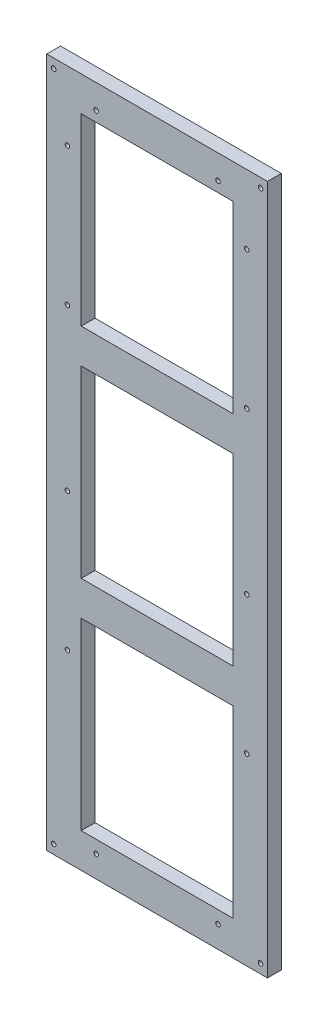
from build123d import *

# Parameters (mm, degrees)
SKETCH1_W           = 96
SKETCH1_H           = 300
SKETCH1_W_2         = 66
SKETCH1_H_2         = 80
BOSS_EXTRUDE1_DEPTH = 6
SKETCH3_R           = 1
CUT_EXTRUDE6_DEPTH  = 10
SKETCH5_R           = 1
CUT_EXTRUDE9_DEPTH  = 10
SKETCH7_R           = 1
CUT_EXTRUDE10_DEPTH = 10


with BuildPart() as part:
    # Sketch1 → Boss-Extrude1 (new body)
    with BuildSketch(Plane.XY):
        with Locations((0, 6)):
            Rectangle(SKETCH1_W, SKETCH1_H)
        with Locations((0, 101)):
            Rectangle(SKETCH1_W_2, SKETCH1_H_2, mode=Mode.SUBTRACT)
        with Locations((0, -89)):
            Rectangle(SKETCH1_W_2, SKETCH1_H_2, mode=Mode.SUBTRACT)
        with Locations((0, 6)):
            Rectangle(SKETCH1_W_2, SKETCH1_H_2, mode=Mode.SUBTRACT)
    extrude(amount=BOSS_EXTRUDE1_DEPTH)

    # Sketch3 → Cut-Extrude6 (cut)
    with BuildSketch(Plane.XY.offset(6)):
        with Locations((-39, 126)):
            Circle(SKETCH3_R)
        with Locations((-39, -4)):
            Circle(SKETCH3_R)
        with Locations((-39, 66)):
            Circle(SKETCH3_R)
        with Locations((-39, -64)):
            Circle(SKETCH3_R)
        with Locations((39, -64)):
            Circle(SKETCH3_R)
        with Locations((39, -4)):
            Circle(SKETCH3_R)
        with Locations((39, 66)):
            Circle(SKETCH3_R)
        with Locations((39, 126)):
            Circle(SKETCH3_R)
    extrude(amount=-CUT_EXTRUDE6_DEPTH, mode=Mode.SUBTRACT)

    # Sketch5 → Cut-Extrude9 (cut)
    with BuildSketch(Plane.XY.offset(6)):
        with Locations((-26.5, -134.5)):
            Circle(SKETCH5_R)
        with Locations((26.5, -134.5)):
            Circle(SKETCH5_R)
        with Locations((-26.5, 145.5)):
            Circle(SKETCH5_R)
        with Locations((26.5, 145.5)):
            Circle(SKETCH5_R)
    extrude(amount=-CUT_EXTRUDE9_DEPTH, mode=Mode.SUBTRACT)

    # Sketch7 → Cut-Extrude10 (cut)
    with BuildSketch(Plane.XY.offset(6)):
        with Locations((45, -140)):
            Circle(SKETCH7_R)
        with Locations((-45, -140)):
            Circle(SKETCH7_R)
        with Locations((45, 152)):
            Circle(SKETCH7_R)
        with Locations((-45, 152)):
            Circle(SKETCH7_R)
    extrude(amount=-CUT_EXTRUDE10_DEPTH, mode=Mode.SUBTRACT)


solid = part.part
